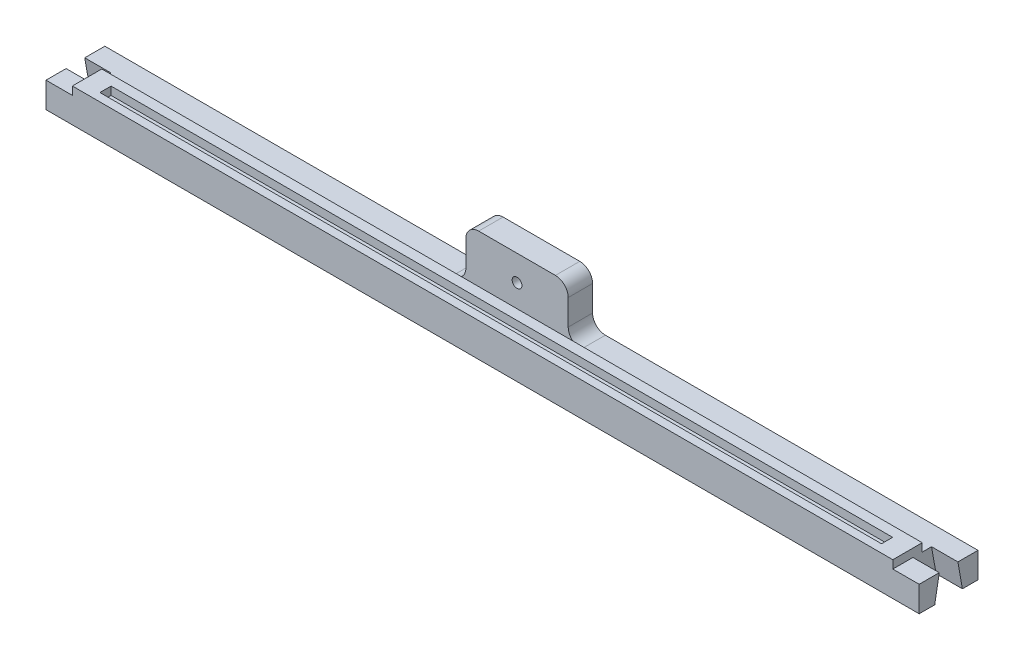
from build123d import *
from OCP.BRepFilletAPI import BRepFilletAPI_MakeChamfer

# Parameters (mm, degrees)
BOSS_EXTRUDE1_DEPTH = 20
SKETCH2_W           = 641.5
SKETCH2_H           = 23
SKETCH2_W_2         = 611.1
SKETCH2_H_2         = 8.73125
BOSS_EXTRUDE2_DEPTH = 6.35
SKETCH4_W           = 80
SKETCH4_H           = 19.05
BOSS_EXTRUDE3_DEPTH = 40
CUT_EXTRUDE2_DEPTH  = 50.8
CHAMFER1_SIZE       = 20
CHAMFER1_SIZE_2     = 3.526539614
FILLET1_R           = 10


with BuildPart() as part:
    # Sketch1 → Boss-Extrude1 (new body)
    with BuildSketch(Plane(origin=(0, 0, 0), x_dir=(1, 0, 0), z_dir=(0, 1, 0))):
        Polygon((-341.35, 23), (-341.35, 7.291), (-320.75, 7.291), (-320.75, -7.291), (-341.35, -7.291), (-341.35, -23), (341.35, -23), (341.35, -7.291), (320.75, -7.291), (320.75, 7.291), (341.35, 7.291), (341.35, 23), align=None)
    extrude(amount=BOSS_EXTRUDE1_DEPTH)

    # Sketch2 → Boss-Extrude2 (add)
    with BuildSketch(Plane(origin=(0, 20, 0), x_dir=(1, 0, 0), z_dir=(0, 1, 0))):
        with Locations((0, -11.5)):
            Rectangle(SKETCH2_W, SKETCH2_H)
        with Locations((0, -12.284375)):
            Rectangle(SKETCH2_W_2, SKETCH2_H_2, mode=Mode.SUBTRACT)
    extrude(amount=BOSS_EXTRUDE2_DEPTH)

    # Sketch4 → Boss-Extrude3 (add)
    with BuildSketch(Plane(origin=(0, 20, 0), x_dir=(1, 0, 0), z_dir=(0, 1, 0))):
        with Locations((0, 13.475)):
            Rectangle(SKETCH4_W, SKETCH4_H)
    extrude(amount=BOSS_EXTRUDE3_DEPTH)

    # Sketch5 → Cut-Extrude2 (cut)
    with BuildSketch(Plane(origin=(0, 0, -23), x_dir=(-1, 0, 0), z_dir=(0, 0, -1))):
        with BuildLine():
            ThreePointArc((3.407767598, 41.703883799), (0, 43.81), (-3.407767598, 41.703883799))
            Line((-3.407767598, 41.703883799), (0, 40))
            Line((0, 40), (3.407767598, 41.703883799))
        make_face()
        with BuildLine():
            Line((0, 40), (-3.407767598, 41.703883799))
            ThreePointArc((-3.407767598, 41.703883799), (-3.81, 40), (-3.407767598, 38.296116201))
            Line((-3.407767598, 38.296116201), (0, 40))
        make_face()
        with BuildLine():
            Line((3.407767598, 41.703883799), (0, 40))
            Line((0, 40), (3.407767598, 38.296116201))
            ThreePointArc((3.407767598, 38.296116201), (3.70807865, 39.124641373), (3.81, 40))
            ThreePointArc((3.81, 40), (3.70807865, 40.875358627), (3.407767598, 41.703883799))
        make_face()
        with BuildLine():
            Line((3.407767598, 38.296116201), (0, 40))
            Line((0, 40), (-3.407767598, 38.296116201))
            ThreePointArc((-3.407767598, 38.296116201), (0, 36.19), (3.407767598, 38.296116201))
        make_face()
    extrude(amount=-CUT_EXTRUDE2_DEPTH, mode=Mode.SUBTRACT)

    # Chamfer1
    chamfer1_edges_1 = [part.edges().sort_by_distance(p)[0] for p in [
        (331.05, 0, -7.291),
    ]]
    chamfer1_side_1 = [part.faces().sort_by_distance(p)[0] for p in [
        (331.05, 0.070530792, -7.291),
    ]]
    chamfer1_edges_2 = [part.edges().sort_by_distance(p)[0] for p in [
        (331.05, 0, 7.291),
    ]]
    chamfer1_side_2 = [part.faces().sort_by_distance(p)[0] for p in [
        (331.05, 0, 7.361530792),
    ]]
    chamfer1_edges_3 = [part.edges().sort_by_distance(p)[0] for p in [
        (-331.05, 0, 7.291),
    ]]
    chamfer1_side_3 = [part.faces().sort_by_distance(p)[0] for p in [
        (-331.05, 0, 7.361530792),
    ]]
    chamfer1_edges_4 = [part.edges().sort_by_distance(p)[0] for p in [
        (-331.05, 0, -7.291),
    ]]
    chamfer1_side_4 = [part.faces().sort_by_distance(p)[0] for p in [
        (-331.05, 0, -7.361530792),
    ]]
    chamfer1 = BRepFilletAPI_MakeChamfer(part.part.solid().wrapped)
    for e in chamfer1_edges_1:
        chamfer1.Add(CHAMFER1_SIZE - 0.0001, CHAMFER1_SIZE_2 - 0.0001, e.wrapped, chamfer1_side_1[0].wrapped)
    for e in chamfer1_edges_2:
        chamfer1.Add(CHAMFER1_SIZE_2 - 0.0001, CHAMFER1_SIZE - 0.0001, e.wrapped, chamfer1_side_2[0].wrapped)
    for e in chamfer1_edges_3:
        chamfer1.Add(CHAMFER1_SIZE_2 - 0.0001, CHAMFER1_SIZE - 0.0001, e.wrapped, chamfer1_side_3[0].wrapped)
    for e in chamfer1_edges_4:
        chamfer1.Add(CHAMFER1_SIZE_2 - 0.0001, CHAMFER1_SIZE - 0.0001, e.wrapped, chamfer1_side_4[0].wrapped)
    add(Compound.cast(chamfer1.Shape()), mode=Mode.REPLACE)  # a hair under: the kernel refuses the full size

    # Fillet1
    fillet1_edges = [part.edges().sort_by_distance(p)[0] for p in [
        (40, 20, -13.475),
        (-40, 60, -13.475),
        (40, 60, -13.475),
        (-40, 20, -13.475),
    ]]
    fillet(fillet1_edges, radius=FILLET1_R)


solid = part.part
